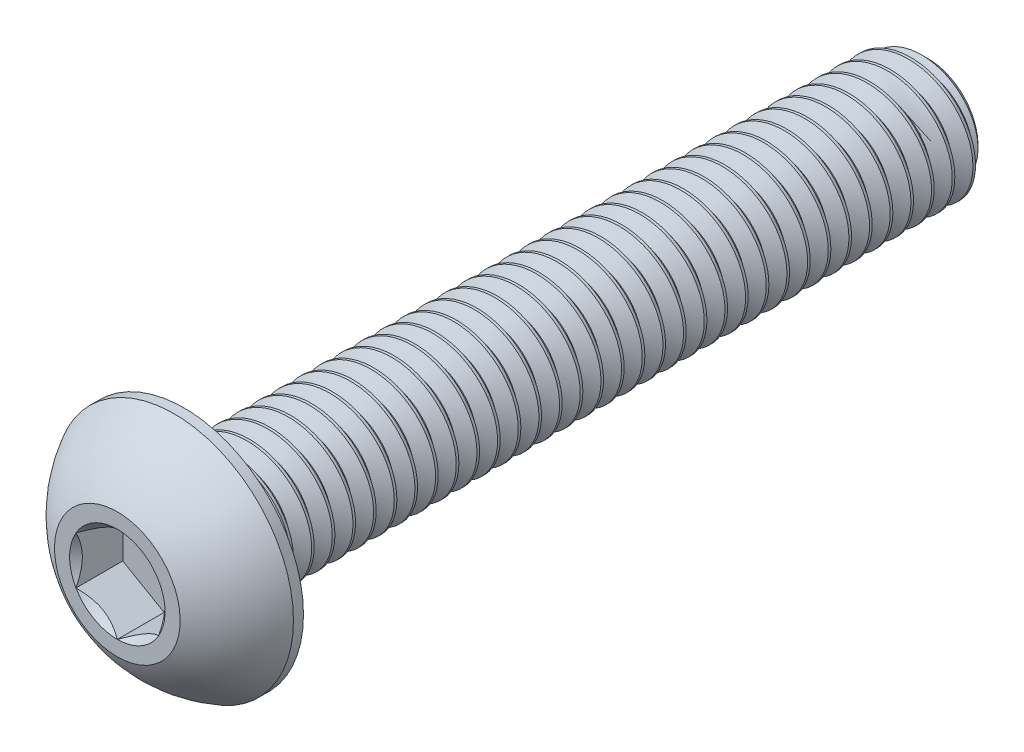
from build123d import *

# Parameters (mm, degrees)
SKETCH11_W         = 28.575
SKETCH11_H         = 2.413
CHAMFER1_SIZE      = 0.49609375
CUT_EXTRUDE2_DEPTH = 1.79578
SKETCH6_R          = 1.833087105
CUT_EXTRUDE3_DEPTH = 1.79578
CUT_EXTRUDE3_TAPER = 45
CUT_SWEEP1_PITCH   = 0.79375
CUT_SWEEP1_TO      = 28.575


with BuildPart() as part:
    # Sketch11 → Revolve1 (revolve)
    with BuildSketch(Plane(origin=(0, 0, 0), x_dir=(0, 0, -1), z_dir=(1, 0, 0)), mode=Mode.PRIVATE) as revolve1_sk:
        with Locations((16.8529, 1.2065)):
            Rectangle(SKETCH11_W, SKETCH11_H)
    revolve(revolve1_sk.sketch.rotate(Axis((0, 0, -2.5654), (0, 0, -1)), 180), axis=Axis((0, 0, -2.5654), (0, 0, -1)))

    # Chamfer1
    chamfer1_edges = [part.edges().sort_by_distance(p)[0] for p in [
        (0, 2.413, -31.1404),
    ]]
    chamfer(chamfer1_edges, length=CHAMFER1_SIZE)

    # Cut-Sweep1: arcs per turn and ends read off the stored shape
    # Cut-Sweep1: the profile of Sketch2 screwed along a right-hand helix through 37 turns, 8 arcs to a turn; built about Z, then put on its axis
    cut_sweep1_z = Axis((0, 0, 0), (0, 0, 1))
    cut_sweep1_corners = [(2.455962979, 0, 0.024804688), (2.455962979, 0, -0.719335937), (1.897444252, 0, -0.396875), (1.897444252, 0, -0.29765625)]
    with BuildLine(mode=Mode.PRIVATE) as cut_sweep1_profile:
        Line(cut_sweep1_corners[0], cut_sweep1_corners[1])
        Line(cut_sweep1_corners[1], cut_sweep1_corners[2])
        Line(cut_sweep1_corners[2], cut_sweep1_corners[3])
        Line(cut_sweep1_corners[3], cut_sweep1_corners[0])
    cut_sweep1_cap = Face(cut_sweep1_profile.wire())
    cut_sweep1_turn_angles = [0, 22.5, 45, 67.5, 90, 112.5, 135, 157.5, 180, 202.5, 225, 247.5, 270, 292.5, 315, 337.5, 360]
    cut_sweep1_turn_weights = [1, 0.9238795325112867, 1, 0.9238795325112867, 1, 0.9238795325112867, 1, 0.9238795325112867, 1, 0.9238795325112867, 1, 0.9238795325112867, 1, 0.9238795325112867, 1, 0.9238795325112867, 1]
    cut_sweep1_turn_rails = [Edge.make_bspline([Vector(p[0], p[1], 0).rotate(cut_sweep1_z, cut_sweep1_turn_angles[k]) / cut_sweep1_turn_weights[k] + Vector(0, 0, p[2] + CUT_SWEEP1_PITCH * cut_sweep1_turn_angles[k] / 360) for k in range(17)], [0, 0, 0, 1, 1, 2, 2, 3, 3, 4, 4, 5, 5, 6, 6, 7, 7, 8, 8, 8], 2, cut_sweep1_turn_weights) for p in cut_sweep1_corners]
    cut_sweep1_turn_sides = [Face.make_surface_from_curves(cut_sweep1_turn_rails[p[0]], cut_sweep1_turn_rails[p[1]]) for p in [(0, 1), (1, 2), (2, 3), (3, 0)]]
    cut_sweep1 = Plane(origin=(0, 0, -31.1404), x_dir=(0, 1, 0), z_dir=(0, 0, 1)) * split(Solid(Shell([*[p.moved(Location((0, 0, CUT_SWEEP1_PITCH * i))) for i in range(37) for p in cut_sweep1_turn_sides], cut_sweep1_cap, cut_sweep1_cap.rotate(cut_sweep1_z, 13320).moved(Location((0, 0, CUT_SWEEP1_PITCH * 13320 / 360)))])), bisect_by=Plane.XY.offset(CUT_SWEEP1_TO), keep=Keep.BOTTOM, mode=Mode.PRIVATE)
    add(cut_sweep1, mode=Mode.SUBTRACT)


with BuildPart() as body_2:
    # Sketch7 → Revolve2 (revolve)
    with BuildSketch(Plane(origin=(0, 0, 0), x_dir=(0, 0, -1), z_dir=(1, 0, 0)), mode=Mode.PRIVATE) as revolve2_sk:
        with BuildLine():
            Line((2.18059, 4.5847), (2.5654, 4.5847))
            Line((2.5654, 4.5847), (2.5654, 0))
            Line((2.5654, 0), (0, 0))
            Line((0, 0), (0, 2.413))
            ThreePointArc((0, 2.413), (0.925030326, 3.664791196), (2.18059, 4.5847))
        make_face()
    revolve(revolve2_sk.sketch.rotate(Axis((0, 0, 0), (0, 0, -1)), 180), axis=Axis((0, 0, 0), (0, 0, -1)))

    # Sketch5 → Cut-Extrude2 (cut)
    with BuildSketch(Plane.XY):
        Polygon((1.5875, -0.916543552), (1.5875, 0.916543552), (0, 1.833087105), (-1.5875, 0.916543552), (-1.5875, -0.916543552), (0, -1.833087105), align=None)
    extrude(amount=-CUT_EXTRUDE2_DEPTH, mode=Mode.SUBTRACT)

    # Sketch6 → Cut-Extrude3 (cut)
    with BuildSketch(Plane.XY):
        Circle(SKETCH6_R)
    extrude(amount=-CUT_EXTRUDE3_DEPTH, taper=CUT_EXTRUDE3_TAPER, mode=Mode.SUBTRACT)


solid = Compound([part.part, body_2.part])
